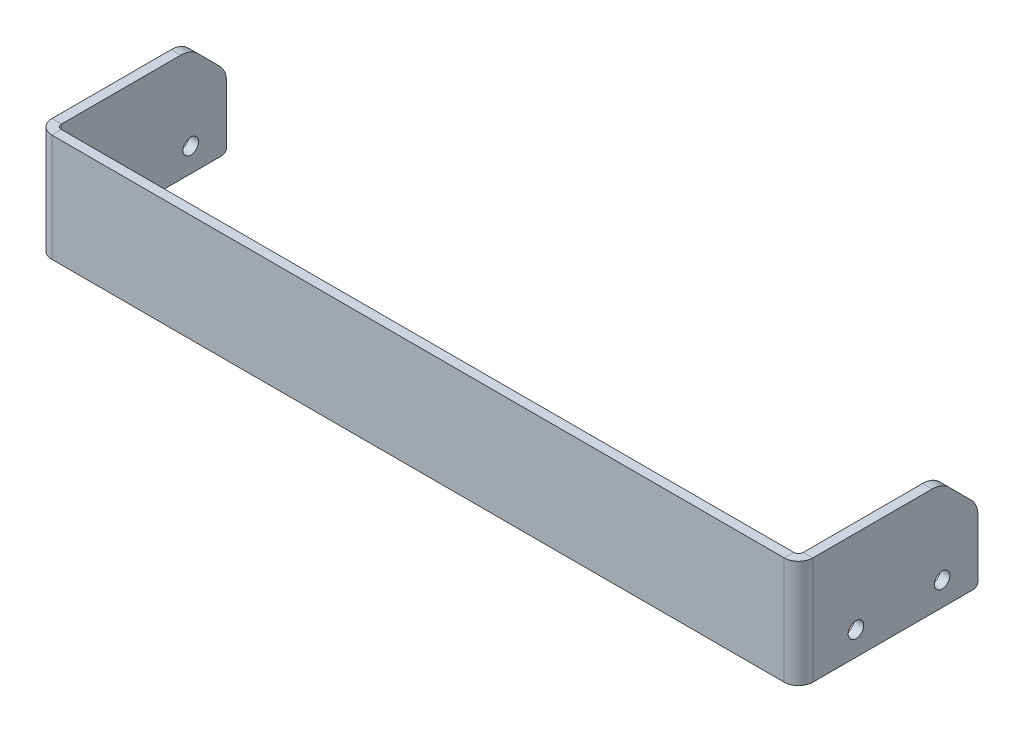
from build123d import *

# Parameters (mm, degrees)
EXTRUDE_THIN1_DEPTH        = 45
CHAMFER1_SIZE              = 15
CONVERT_SOLID1_DEPTH       = 45
CONVERT_SOLID1_2_DEPTH     = 45
FILLET1_R                  = 2
FILLET2_R                  = 10
F_6_5_6_5_DIAMETER_HOLE1_D = 6.5
F_6_5_6_5_DIAMETER_HOLE2_D = 6.5


# Read off the part's stored shape, not the designer's step: Convert-Solid1
with BuildPart() as part:
    # Sketch1 → Extrude-Thin1 (new body)
    with BuildSketch(Plane(origin=(0, 0, 0), x_dir=(1, 0, 0), z_dir=(0, 1, 0))):
        Polygon((-159, 75), (-159, 0), (159, 0), (159, 75), (155, 75), (155, 4), (-155, 4), (-155, 75), align=None)
    extrude(amount=EXTRUDE_THIN1_DEPTH)

    # Chamfer1
    chamfer1_edges = [part.edges().sort_by_distance(p)[0] for p in [
        (-157, 45, -75),
        (157, 45, -75),
    ]]
    chamfer(chamfer1_edges, length=CHAMFER1_SIZE)

    # Convert-Solid1 outline → Convert-Solid1 (cut)
    with BuildSketch(Plane(origin=(0, 0, 0), x_dir=(1, 0, 0), z_dir=(0, 1, 0))):
        with BuildLine():
            Line((-159, 0), (-153, 0))
            ThreePointArc((-153, 0), (-157.242640687, 1.757359313), (-159, 6))
            Line((-159, 6), (-159, 0))
        make_face()
        with BuildLine():
            ThreePointArc((159, 6), (157.242640687, 1.757359313), (153, 0))
            Line((153, 0), (159, 0))
            Line((159, 0), (159, 6))
        make_face()
    extrude(amount=CONVERT_SOLID1_DEPTH, mode=Mode.SUBTRACT)

    # Convert-Solid1 2 outline → Convert-Solid1 2 (add)
    with BuildSketch(Plane(origin=(0, 0, 0), x_dir=(1, 0, 0), z_dir=(0, 1, 0))):
        with BuildLine():
            Line((-155, 4), (-153, 4))
            ThreePointArc((-153, 4), (-154.414213562, 4.585786438), (-155, 6))
            Line((-155, 6), (-155, 4))
        make_face()
        with BuildLine():
            ThreePointArc((155, 6), (154.414213562, 4.585786438), (153, 4))
            Line((153, 4), (155, 4))
            Line((155, 4), (155, 6))
        make_face()
    extrude(amount=CONVERT_SOLID1_2_DEPTH)

    # Fillet1
    fillet1_edges = [part.edges().sort_by_distance(p)[0] for p in [
        (157, 0, -75),
        (-157, 0, -75),
    ]]
    fillet(fillet1_edges, radius=FILLET1_R)

    # Fillet2
    fillet2_edges = [part.edges().sort_by_distance(p)[0] for p in [
        (157, 30, -75),
        (157, 45, -60),
        (-157, 45, -60),
        (-157, 30, -75),
    ]]
    fillet(fillet2_edges, radius=FILLET2_R)

    # Ø6.5 (6.5) Diameter Hole1 (through all)
    with Locations(Plane(origin=(-159, 22, -202.5), x_dir=(0, 0, 1), z_dir=(-1, 0, 0))):
        with Locations((-178.5, -12), (-142.5, -12), (142.5, -12), (178.5, -12)):
            Hole(F_6_5_6_5_DIAMETER_HOLE1_D / 2)

    # Ø6.5 (6.5) Diameter Hole2 (through all)
    with Locations(Plane(origin=(159, 22, -202.5), x_dir=(0, 0, -1), z_dir=(1, 0, 0))):
        with Locations((-178.5, -12), (-142.5, -12), (142.5, -12), (178.5, -12)):
            Hole(F_6_5_6_5_DIAMETER_HOLE2_D / 2)


solid = part.part
